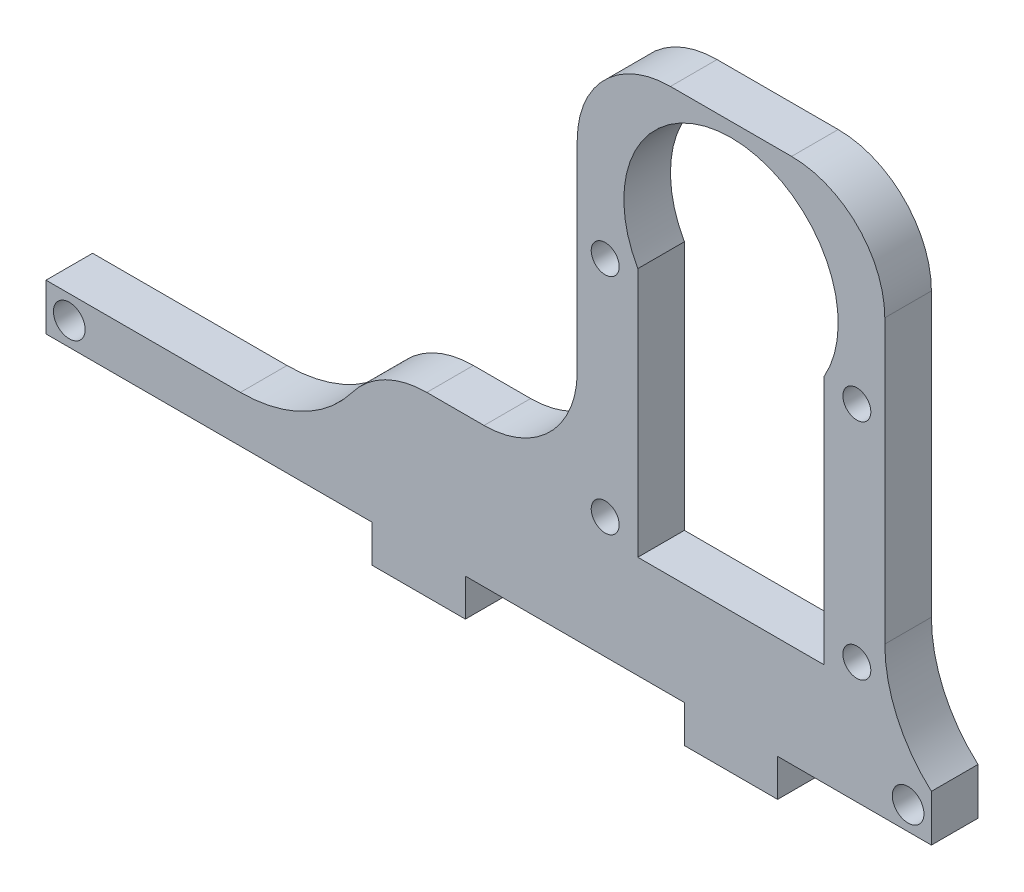
from build123d import *

# Parameters (mm, degrees)
SKETCH2_R          = 1.5
SKETCH2_R_2        = 1.7
BASE_FLANGE1_DEPTH = 5
FILLET1_R          = 15
FILLET2_R          = 10


# Sheet-metal steps are written as plain solids
with BuildPart() as part:
    # Sketch2 → Base-Flange1 (new body)
    with BuildSketch(Plane.XY):
        with BuildLine():
            Line((-6.5, 13), (6.5, 13))
            ThreePointArc((6.5, 13), (13.571067812, 10.071067812), (16.5, 3))
            Line((16.5, 3), (16.5, -38.5))
            Line((16.5, -38.5), (21.5, -38.5))
            Line((21.5, -38.5), (21.5, -43.5))
            Line((21.5, -43.5), (16.5, -43.5))
            Line((16.5, -43.5), (5, -43.5))
            Line((5, -43.5), (5, -47.5))
            Line((5, -47.5), (-5, -47.5))
            Line((-5, -47.5), (-5, -43.5))
            Line((-5, -43.5), (-28.5, -43.5))
            Line((-28.5, -43.5), (-28.5, -47.5))
            Line((-28.5, -47.5), (-38.5, -47.5))
            Line((-38.5, -47.5), (-38.5, -43.5))
            Line((-38.5, -43.5), (-73.5, -43.5))
            Line((-73.5, -43.5), (-73.5, -38.5))
            Line((-73.5, -38.5), (-38.5, -38.5))
            Line((-38.5, -38.5), (-38.5, -28.5))
            Line((-38.5, -28.5), (-16.5, -28.5))
            Line((-16.5, -28.5), (-16.5, 3))
            ThreePointArc((-16.5, 3), (-13.571067812, 10.071067812), (-6.5, 13))
        make_face()
        with Locations((-13.5, -6.5)):
            Circle(SKETCH2_R, mode=Mode.SUBTRACT)
        with Locations((-13.5, -30.5)):
            Circle(SKETCH2_R, mode=Mode.SUBTRACT)
        with Locations((13.5, -6.5)):
            Circle(SKETCH2_R, mode=Mode.SUBTRACT)
        with Locations((13.5, -30.5)):
            Circle(SKETCH2_R, mode=Mode.SUBTRACT)
        with Locations((19, -41)):
            Circle(SKETCH2_R_2, mode=Mode.SUBTRACT)
        with Locations((-71, -41)):
            Circle(SKETCH2_R_2, mode=Mode.SUBTRACT)
        with BuildLine():
            Line((-10, -5.678908346), (-10, -32.5))
            Line((-10, -32.5), (10, -32.5))
            Line((10, -32.5), (10, -5.678908346))
            ThreePointArc((10, -5.678908346), (0, 11.5), (-10, -5.678908346))
        make_face(mode=Mode.SUBTRACT)
    extrude(amount=-BASE_FLANGE1_DEPTH)

    # Fillet1
    # the kernel refuses this fillet: 15 mm, written as the material it adds along each edge
    with BuildSketch(Plane(origin=(-38.5, -38.5, 0), x_dir=(0, 1, 0), z_dir=(0, 0, -1))) as fillet1_piece_1:
        with BuildLine():
            CenterArc((15, -14.142135624), FILLET1_R, 109.471220634, 70.528779366)
            Line((0, -14.142135624), (-0.3, -14.142135624))
            Line((-0.3, -14.142135624), (-0.3, 0))
            Line((-0.3, 0), (0, 0.3))
            ThreePointArc((0, 0.3), (5, 0.3), (9.9, 0.282842712))
            Line((9.9, 0.282842712), (10, 0))
        make_face()
    extrude(amount=5)
    with BuildSketch(Plane(origin=(16.5, -38.5, 0), x_dir=(1, 0, 0), z_dir=(0, 0, -1))) as fillet1_piece_2:
        with BuildLine():
            CenterArc((15, -11.180339887), FILLET1_R, 131.810314896, 48.189685104)
            Line((0, -11.180339887), (-0.3, -11.180339887))
            Line((-0.3, -11.180339887), (-0.3, 0))
            Line((-0.3, 0), (0, 0.3))
            ThreePointArc((0, 0.3), (2.5, 0.3), (4.8, 0.223606798))
            Line((4.8, 0.223606798), (5, 0))
        make_face()
    extrude(amount=5)

    # Fillet2
    fillet2_edges = [part.edges().sort_by_distance(p)[0] for p in [
        (-38.5, -28.5, -2.5),
        (-16.5, -28.5, -2.5),
    ]]
    fillet(fillet2_edges, radius=FILLET2_R)


solid = part.part
